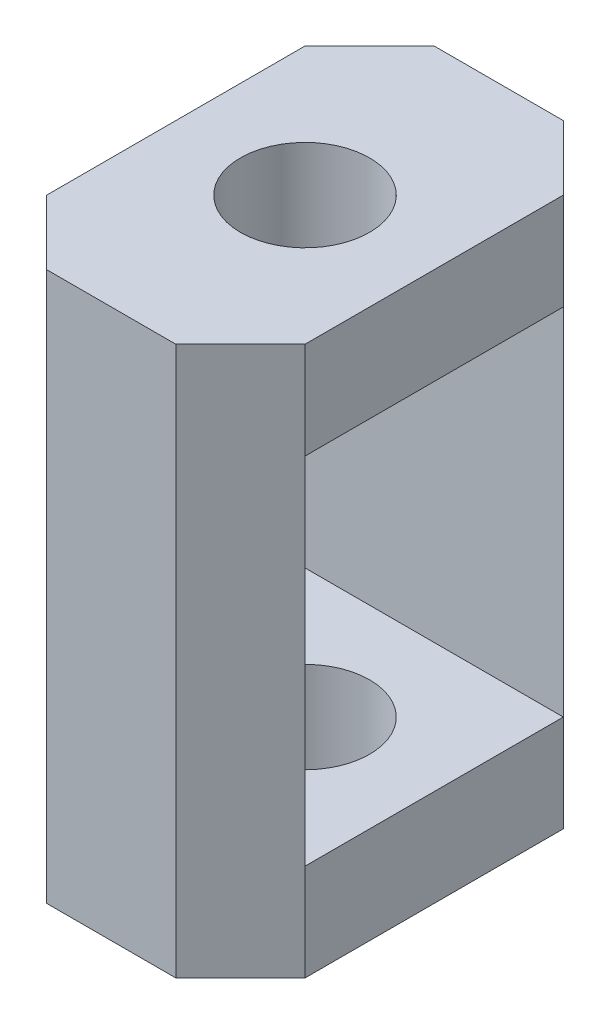
from build123d import *

# Parameters (mm, degrees)
SKETCH1_W           = 8
SKETCH1_H           = 12
SKETCH1_R           = 2
BOSS_EXTRUDE1_DEPTH = 17
SKETCH2_W           = 8
SKETCH2_H           = 11
CUT_EXTRUDE1_DEPTH  = 17
CHAMFER1_SIZE       = 2


with BuildPart() as part:
    # Sketch1 → Boss-Extrude1 (new body)
    with BuildSketch(Plane(origin=(0, 0, 0), x_dir=(1, 0, 0), z_dir=(0, 1, 0))):
        Rectangle(SKETCH1_W, SKETCH1_H)
        with Locations(Location((0, 0, 0), (0, 0, 270))):
            Circle(SKETCH1_R, mode=Mode.SUBTRACT)
    extrude(amount=BOSS_EXTRUDE1_DEPTH)

    # Sketch2 → Cut-Extrude1 (cut)
    with BuildSketch(Plane(origin=(4, 0, 0), x_dir=(0, 0, -1), z_dir=(1, 0, 0))):
        with Locations((0, 8.5)):
            Rectangle(SKETCH2_W, SKETCH2_H)
    extrude(amount=-CUT_EXTRUDE1_DEPTH, mode=Mode.SUBTRACT)

    # Chamfer1
    chamfer1_edges = [part.edges().sort_by_distance(p)[0] for p in [
        (4, 8.5, 6),
        (-4, 8.5, 6),
        (-4, 8.5, -6),
        (4, 8.5, -6),
    ]]
    chamfer(chamfer1_edges, length=CHAMFER1_SIZE - 0.0001)  # a hair under: the kernel refuses the full size


solid = part.part
